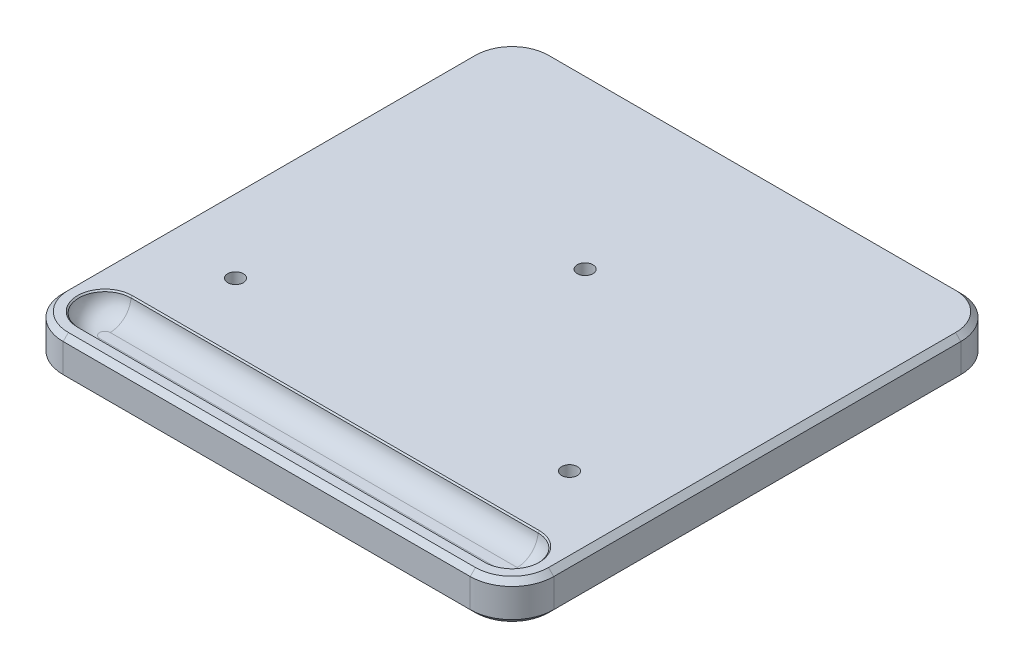
from build123d import *

# Parameters (mm, degrees)
BOSS_EXTRUDE1_DEPTH      = 76.2
BOSS_EXTRUDE1_DEPTH_BACK = 76.2
SKETCH3_W                = 152.4
SKETCH3_H                = 11.90625
SKETCH8_OUTSIDE_W        = 197.57
SKETCH8_OUTSIDE_H        = 197.57
CUT_EXTRUDE2_DEPTH       = 109.41881197
CHAMFER1_SIZE            = 1.5875
PEN_SLOT_CUT_DEPTH       = 6.35
PEN_SLOT_FILLET_R        = 6.35
HOLE1_D                  = 4.7625
HOLE1_CBORE_D            = 12.7
HOLE1_CBORE_DEPTH        = 6.35
SKETCH6_R                = 6.746875
CUT_EXTRUDE1_DEPTH       = 1.524
BASE_CHAMFERS_SIZE       = 0.79375


# Some blends are built 0.0001 mm under size
with BuildPart() as part:
    # Sketch3 → Boss-Extrude1 (new, two sides: drawn at the far end of the back side and taken through both)
    with BuildSketch(Plane(origin=(0, 0, 0), x_dir=(0, 0, -1), z_dir=(1, 0, 0)).offset(-BOSS_EXTRUDE1_DEPTH_BACK)):
        Rectangle(SKETCH3_W, SKETCH3_H)
    extrude(amount=BOSS_EXTRUDE1_DEPTH + BOSS_EXTRUDE1_DEPTH_BACK)

    # Sketch8 outside → Cut-Extrude2 (cut, through all)
    with BuildSketch(Plane.XZ.offset(5.953125)):
        Rectangle(SKETCH8_OUTSIDE_W, SKETCH8_OUTSIDE_H)
        with BuildLine():
            Line((-61.9125, -74.6125), (61.9125, -74.6125))
            ThreePointArc((61.9125, -74.6125), (70.892756121, -70.892756121), (74.6125, -61.9125))
            Line((74.6125, -61.9125), (74.6125, 61.9125))
            ThreePointArc((74.6125, 61.9125), (70.892756121, 70.892756121), (61.9125, 74.6125))
            Line((61.9125, 74.6125), (-61.9125, 74.6125))
            ThreePointArc((-61.9125, 74.6125), (-70.892756121, 70.892756121), (-74.6125, 61.9125))
            Line((-74.6125, 61.9125), (-74.6125, -61.9125))
            ThreePointArc((-74.6125, -61.9125), (-70.892756121, -70.892756121), (-61.9125, -74.6125))
        make_face(mode=Mode.SUBTRACT)
    extrude(amount=-CUT_EXTRUDE2_DEPTH, mode=Mode.SUBTRACT)

    # Chamfer1
    chamfer1_edges = [part.edges().sort_by_distance(p)[0] for p in [
        (-74.6125, 5.953125, 0),
        (-70.892756121, 5.953125, -70.892756121),
        (0, 5.953125, -74.6125),
        (70.892756121, 5.953125, -70.892756121),
        (74.6125, 5.953125, 0),
        (70.892756121, 5.953125, 70.892756121),
        (0, 5.953125, 74.6125),
        (-70.892756121, 5.953125, 70.892756121),
        (-70.892756121, -5.953125, -70.892756121),
        (-74.6125, -5.953125, 0),
        (-70.892756121, -5.953125, 70.892756121),
        (0, -5.953125, 74.6125),
        (70.892756121, -5.953125, 70.892756121),
        (74.6125, -5.953125, 0),
        (70.892756121, -5.953125, -70.892756121),
        (0, -5.953125, -74.6125),
    ]]
    chamfer(chamfer1_edges, length=CHAMFER1_SIZE)

    # Pen Slot Sketch → Pen Slot Cut (cut)
    with BuildSketch(Plane(origin=(0, 5.953125, 0), x_dir=(1, 0, 0), z_dir=(0, 1, 0))):
        with BuildLine():
            Line((-61.9125, -53.975), (61.9125, -53.975))
            ThreePointArc((61.9125, -53.975), (69.85, -61.9125), (61.9125, -69.85))
            Line((61.9125, -69.85), (-61.9125, -69.85))
            ThreePointArc((-61.9125, -69.85), (-69.85, -61.9125), (-61.9125, -53.975))
        make_face()
    extrude(amount=-PEN_SLOT_CUT_DEPTH, mode=Mode.SUBTRACT)

    # Pen Slot Fillet
    pen_slot_fillet_edges = [part.edges().sort_by_distance(p)[0] for p in [
        (0, -0.396875, 53.975),
        (69.85, -0.396875, 61.9125),
        (0, -0.396875, 69.85),
        (-69.85, -0.396875, 61.9125),
    ]]
    fillet(pen_slot_fillet_edges, radius=PEN_SLOT_FILLET_R - 0.0001)  # a hair under: the kernel refuses the full size

    # Hole1 (through all)
    with Locations(Plane(origin=(-50.8, -5.953125, 33.30776944), x_dir=(0, 0, -1), z_dir=(0, -1, 0))):
        with Locations((0, 0), (0, 101.6), (55.531312028, 50.8)):
            CounterBoreHole(HOLE1_D / 2, HOLE1_CBORE_D / 2, HOLE1_CBORE_DEPTH)

    # Sketch6 → Cut-Extrude1 (cut)
    with BuildSketch(Plane(origin=(0, -5.953125, 0), x_dir=(-1, 0, 0), z_dir=(0, -1, 0))):
        with Locations(Location((-61.9125, 61.9125, 0), (0, 0, 90))):
            Circle(SKETCH6_R)
        with Locations(Location((61.9125, 61.9125, 0), (0, 0, 90))):
            Circle(SKETCH6_R)
        with Locations(Location((61.9125, -61.9125, 0), (0, 0, 90))):
            Circle(SKETCH6_R)
        with Locations(Location((-61.9125, -61.9125, 0), (0, 0, 90))):
            Circle(SKETCH6_R)
    extrude(amount=-CUT_EXTRUDE1_DEPTH, mode=Mode.SUBTRACT)

    # Chamfer2
    # the kernel refuses this chamfer: 0.396875 mm, written as the material it takes off along each edge
    with BuildSketch(Plane(origin=(-61.9125, 5.953125, 61.9125), x_dir=(0, 0, 1), z_dir=(1, 0, 0))) as chamfer2_piece_1:
        with BuildLine():
            Line((7.853310099, 0.481064901), (8.418564901, -0.084189901))
            Line((8.418564901, -0.084189901), (8.418564901, -0.143721151))
            ThreePointArc((8.418564901, -0.143721151), (8.178032451, -0.05953125), (7.9375, -0.05953125))
            Line((7.9375, -0.05953125), (7.87796875, 0))
            ThreePointArc((7.87796875, 0), (7.87796875, 0.240532451), (7.793778849, 0.481064901))
            Line((7.793778849, 0.481064901), (7.853310099, 0.481064901))
        make_face()
    revolve(axis=Axis((-61.9125, 5.953125, 61.9125), (0, -1, 0)), revolution_arc=180, mode=Mode.SUBTRACT)
    with BuildSketch(Plane(origin=(61.9125, 5.953125, 69.85), x_dir=(0, 0.17238737169530088, 0.9850292351397425), z_dir=(-1, 0, 0))) as chamfer2_piece_2:
        with BuildLine():
            Line((0.488376267, 0), (-0.165859028, -0.459349716))
            Line((-0.165859028, -0.459349716), (-0.224499049, -0.44908728))
            ThreePointArc((-0.224499049, -0.44908728), (-0.100104779, -0.22666906), (-0.058640022, 0.010262436))
            Line((-0.058640022, 0.010262436), (0.010262436, 0.058640022))
            ThreePointArc((0.010262436, 0.058640022), (0.247193932, 0.017175265), (0.498638703, 0.058640022))
            Line((0.498638703, 0.058640022), (0.488376267, 0))
        make_face()
    extrude(amount=123.825, mode=Mode.SUBTRACT)
    with BuildSketch(Plane(origin=(61.9125, 5.953125, 61.9125), x_dir=(0, 0, -1), z_dir=(-1, 0, 0))) as chamfer2_piece_3:
        with BuildLine():
            Line((8.418564901, -0.084189901), (7.853310099, 0.481064901))
            Line((7.853310099, 0.481064901), (7.793778849, 0.481064901))
            ThreePointArc((7.793778849, 0.481064901), (7.87796875, 0.240532451), (7.87796875, 0))
            Line((7.87796875, 0), (7.9375, -0.05953125))
            ThreePointArc((7.9375, -0.05953125), (8.178032451, -0.05953125), (8.418564901, -0.143721151))
            Line((8.418564901, -0.143721151), (8.418564901, -0.084189901))
        make_face()
    revolve(axis=Axis((61.9125, 5.953125, 61.9125), (0, -1, 0)), revolution_arc=180, mode=Mode.SUBTRACT)
    with BuildSketch(Plane(origin=(-61.9125, 5.953125, 53.975), x_dir=(0, -0.9850292351397427, 0.17238737169529986), z_dir=(1, 0, 0))) as chamfer2_piece_4:
        with BuildLine():
            Line((0.488376267, 0), (-0.165859028, 0.459349716))
            Line((-0.165859028, 0.459349716), (-0.224499049, 0.44908728))
            ThreePointArc((-0.224499049, 0.44908728), (-0.100104779, 0.22666906), (-0.058640022, -0.010262436))
            Line((-0.058640022, -0.010262436), (0.010262436, -0.058640022))
            ThreePointArc((0.010262436, -0.058640022), (0.247193932, -0.017175265), (0.498638703, -0.058640022))
            Line((0.498638703, -0.058640022), (0.488376267, 0))
        make_face()
    extrude(amount=123.825, mode=Mode.SUBTRACT)
    with BuildSketch(Plane(origin=(61.9125, -5.953125, 61.9125), x_dir=(0, 0, -1), z_dir=(-1, 0, 0))) as chamfer2_piece_5:
        with BuildLine():
            Line((7.227939901, 0.084189901), (6.662685099, -0.481064901))
            Line((6.662685099, -0.481064901), (6.603153849, -0.481064901))
            ThreePointArc((6.603153849, -0.481064901), (6.68734375, -0.240532451), (6.68734375, 0))
            Line((6.68734375, 0), (6.746875, 0.05953125))
            ThreePointArc((6.746875, 0.05953125), (6.987407451, 0.05953125), (7.227939901, 0.143721151))
            Line((7.227939901, 0.143721151), (7.227939901, 0.084189901))
        make_face()
    revolve(axis=Axis((61.9125, -5.953125, 61.9125), (0, -1, 0)), mode=Mode.SUBTRACT)
    with BuildSketch(Plane(origin=(-61.9125, -5.953125, 61.9125), x_dir=(0, 0, -1), z_dir=(-1, 0, 0))) as chamfer2_piece_6:
        with BuildLine():
            Line((7.227939901, 0.084189901), (6.662685099, -0.481064901))
            Line((6.662685099, -0.481064901), (6.603153849, -0.481064901))
            ThreePointArc((6.603153849, -0.481064901), (6.68734375, -0.240532451), (6.68734375, 0))
            Line((6.68734375, 0), (6.746875, 0.05953125))
            ThreePointArc((6.746875, 0.05953125), (6.987407451, 0.05953125), (7.227939901, 0.143721151))
            Line((7.227939901, 0.143721151), (7.227939901, 0.084189901))
        make_face()
    revolve(axis=Axis((-61.9125, -5.953125, 61.9125), (0, -1, 0)), mode=Mode.SUBTRACT)
    with BuildSketch(Plane(origin=(-61.9125, -5.953125, -61.9125), x_dir=(0, 0, -1), z_dir=(-1, 0, 0))) as chamfer2_piece_7:
        with BuildLine():
            Line((7.227939901, 0.084189901), (6.662685099, -0.481064901))
            Line((6.662685099, -0.481064901), (6.603153849, -0.481064901))
            ThreePointArc((6.603153849, -0.481064901), (6.68734375, -0.240532451), (6.68734375, 0))
            Line((6.68734375, 0), (6.746875, 0.05953125))
            ThreePointArc((6.746875, 0.05953125), (6.987407451, 0.05953125), (7.227939901, 0.143721151))
            Line((7.227939901, 0.143721151), (7.227939901, 0.084189901))
        make_face()
    revolve(axis=Axis((-61.9125, -5.953125, -61.9125), (0, -1, 0)), mode=Mode.SUBTRACT)
    with BuildSketch(Plane(origin=(61.9125, -5.953125, -61.9125), x_dir=(0, 0, -1), z_dir=(-1, 0, 0))) as chamfer2_piece_8:
        with BuildLine():
            Line((7.227939901, 0.084189901), (6.662685099, -0.481064901))
            Line((6.662685099, -0.481064901), (6.603153849, -0.481064901))
            ThreePointArc((6.603153849, -0.481064901), (6.68734375, -0.240532451), (6.68734375, 0))
            Line((6.68734375, 0), (6.746875, 0.05953125))
            ThreePointArc((6.746875, 0.05953125), (6.987407451, 0.05953125), (7.227939901, 0.143721151))
            Line((7.227939901, 0.143721151), (7.227939901, 0.084189901))
        make_face()
    revolve(axis=Axis((61.9125, -5.953125, -61.9125), (0, -1, 0)), mode=Mode.SUBTRACT)

    # Base Chamfers
    base_chamfers_edges = [part.edges().sort_by_distance(p)[0] for p in [
        (0, -5.953125, -15.873542588),
        (50.8, -5.953125, 39.65776944),
        (-50.8, -5.953125, 39.65776944),
    ]]
    chamfer(base_chamfers_edges, length=BASE_CHAMFERS_SIZE)


solid = part.part
